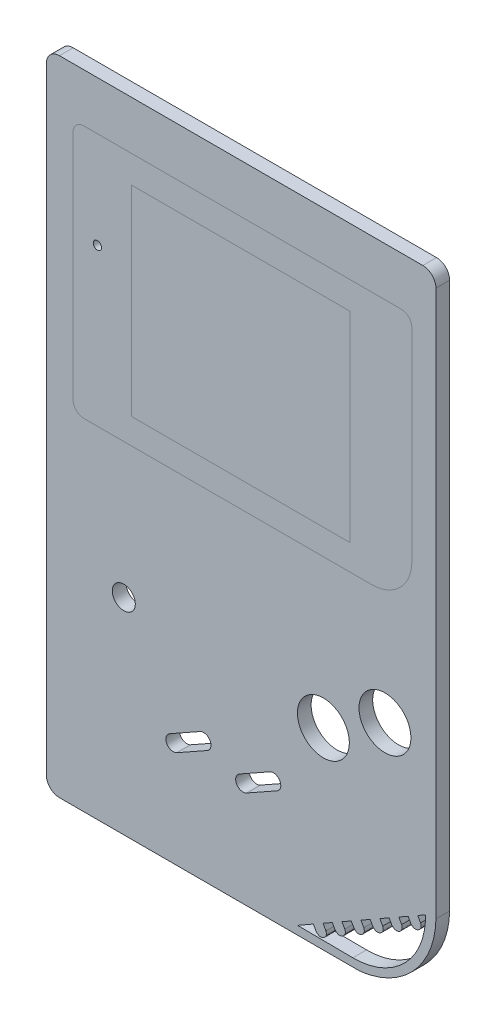
from build123d import *

# Parameters (mm, degrees)
SKETCH1_R           = 2.641507721
SKETCH1_R_2         = 5.95
BOSS_EXTRUDE1_DEPTH = 3.14
SKETCH1_3_W         = 50.090098238
SKETCH1_3_H         = 45.92830966
SKETCH1_3_R         = 0.946417344
BOSS_EXTRUDE2_DEPTH = 3.14
SKETCH1_4_W         = 50.090098238
SKETCH1_4_H         = 45.92830966
BOSS_EXTRUDE3_DEPTH = 3.14


with BuildPart() as part:
    # Sketch1 → Boss-Extrude1 (new body)
    with BuildSketch(Plane.XY):
        with BuildLine():
            add(Edge.make_bspline(
                [(-41.648963672, 73.647136153), (-44.643488897, 73.643488897), (-44.647136153, 70.648963672)],
                knots=[3.927599805, 3.927599805, 3.927599805, 5.497178156, 5.497178156, 5.497178156], degree=2, weights=[1, 0.707537269, 1]))
            Line((-44.647136153, 70.648963672), (-44.647136153, -70.648963672))
            add(Edge.make_bspline(
                [(-44.647136153, -70.648963672), (-44.643488897, -73.643488897), (-41.648963672, -73.647136153)],
                knots=[3.927599805, 3.927599805, 3.927599805, 5.497178156, 5.497178156, 5.497178156], degree=2, weights=[1, 0.707537269, 1]))
            Line((-41.648963672, -73.647136153), (27.093393639, -73.647136153))
            add(Edge.make_bspline(
                [(44.647136153, -54.550700861), (44.629350083, -55.622608831), (44.523578432, -56.687840097), (44.215717336, -58.366181711), (44.071515423, -58.983678353), (43.719242041, -60.213836545), (43.51280516, -60.820227412), (42.807525079, -62.600781834), (42.22206304, -63.742215888), (41.337337041, -65.108539745), (41.152542037, -65.37883334), (40.771685792, -65.906986664), (40.57512321, -66.165654002), (39.967232089, -66.92560473), (39.108255703, -67.89614606), (38.152323748, -68.781197278), (37.146406736, -69.622175477), (36.615243643, -70.022491506), (34.981146078, -71.128530207), (33.83112161, -71.747972893), (32.318701378, -72.376617626), (32.012437216, -72.49499434), (31.392225647, -72.716804064), (31.077608459, -72.820394039), (30.133341911, -73.105042114), (29.500121034, -73.261325902), (28.276366882, -73.499851982), (27.686391293, -73.587126278), (27.093393639, -73.647136153)],
                knots=[0.018260035, 0.018260035, 0.018260035, 0.018260035, 0.125, 0.125, 0.1875, 0.1875, 0.25, 0.25, 0.375, 0.375, 0.40625, 0.40625, 0.4375, 0.4375, 0.5, 0.5625, 0.5625, 0.625, 0.625, 0.75, 0.75, 0.78125, 0.78125, 0.8125, 0.8125, 0.875, 0.875, 0.932610516, 0.932610516, 0.932610516, 0.932610516], degree=3))
            Line((44.647136153, -54.550700861), (44.647136153, 70.648963672))
            add(Edge.make_bspline(
                [(44.647136153, 70.648963672), (44.643488897, 73.643488897), (41.648963672, 73.647136153)],
                knots=[3.927599805, 3.927599805, 3.927599805, 5.497178156, 5.497178156, 5.497178156], degree=2, weights=[1, 0.707537269, 1]))
            Line((41.648963672, 73.647136153), (-41.648963672, 73.647136153))
        make_face()
        with BuildLine():
            Line((38.261273047, -57.229278105), (38.907697093, -58.387645821))
            add(Edge.make_bspline(
                [(41.127626747, -57.132855291), (41.177512702, -57.275656276), (41.228106722, -57.420254043), (41.256744151, -57.64558809), (41.258297908, -57.721643961), (41.241650366, -57.87609041), (41.224028558, -57.95294291), (41.148484091, -58.17567951), (41.066535325, -58.317956891), (40.857909664, -58.566528441), (40.727723519, -58.674853763), (40.444119985, -58.836761885), (40.286598668, -58.894664054), (39.968707451, -58.950297468), (39.803862255, -58.948271189), (39.500496898, -58.865028882), (39.366175077, -58.78700698), (39.123752347, -58.600527557), (39.016103627, -58.493707281), (38.907697093, -58.387645821)],
                knots=[0, 0, 0, 0, 0.125, 0.125, 0.1875, 0.1875, 0.25, 0.25, 0.375, 0.375, 0.5, 0.5, 0.625, 0.625, 0.75, 0.75, 0.875, 0.875, 1, 1, 1, 1], degree=3))
            Line((41.127626747, -57.132855291), (40.475513206, -55.964292213))
            Line((40.475513206, -55.964292213), (42.251050135, -54.949935592))
            Line((42.251050135, -54.949935592), (42.252455494, -55.053896358))
            add(Edge.make_bspline(
                [(25.602086463, -71.801321679), (42.480622356, -71.932432252), (42.252455494, -55.053896358)],
                knots=[5.7564235, 5.7564235, 5.7564235, 7.348402458, 7.348402458, 7.348402458], degree=2, weights=[1, 0.69957807, 1]))
            Line((25.602086463, -71.801321679), (12.926613949, -71.702860031))
            Line((12.926613949, -71.702860031), (16.553952187, -69.630577275))
            Line((16.553952187, -69.630577275), (17.200376234, -70.788944991))
            add(Edge.make_bspline(
                [(19.420305888, -69.534154461), (19.470191843, -69.676955446), (19.520785863, -69.821553213), (19.549423292, -70.04688726), (19.550977048, -70.122943131), (19.534329506, -70.27738958), (19.516707699, -70.35424208), (19.441163231, -70.57697868), (19.359214465, -70.719256061), (19.150588804, -70.967827611), (19.02040266, -71.076152933), (18.736799125, -71.238061055), (18.579277808, -71.295963224), (18.261386592, -71.351596638), (18.096541395, -71.349570359), (17.793176039, -71.266328052), (17.658854217, -71.18830615), (17.416431488, -71.001826727), (17.308782767, -70.895006451), (17.200376234, -70.788944991)],
                knots=[0, 0, 0, 0, 0.125, 0.125, 0.1875, 0.1875, 0.25, 0.25, 0.375, 0.375, 0.5, 0.5, 0.625, 0.625, 0.75, 0.75, 0.875, 0.875, 1, 1, 1, 1], degree=3))
            Line((19.420305888, -69.534154461), (18.76819331, -68.365590833))
            Line((18.76819331, -68.365590833), (20.895416359, -67.150317441))
            Line((20.895416359, -67.150317441), (21.541840405, -68.308685157))
            add(Edge.make_bspline(
                [(23.76177006, -67.053894627), (23.811656014, -67.196695612), (23.862250035, -67.341293379), (23.890887464, -67.566627426), (23.89244122, -67.642683297), (23.875793678, -67.797129746), (23.858171871, -67.873982246), (23.782627403, -68.096718846), (23.700678637, -68.238996227), (23.492052976, -68.487567777), (23.361866832, -68.595893099), (23.078263297, -68.757801221), (22.92074198, -68.81570339), (22.602850764, -68.871336804), (22.438005567, -68.869310525), (22.134640211, -68.786068218), (22.000318389, -68.708046316), (21.75789566, -68.521566893), (21.650246939, -68.414746617), (21.541840405, -68.308685157)],
                knots=[0, 0, 0, 0, 0.125, 0.125, 0.1875, 0.1875, 0.25, 0.25, 0.375, 0.375, 0.5, 0.5, 0.625, 0.625, 0.75, 0.75, 0.875, 0.875, 1, 1, 1, 1], degree=3))
            Line((23.76177006, -67.053894627), (23.109656518, -65.885331549))
            Line((23.109656518, -65.885331549), (25.236880531, -64.670057607))
            Line((25.236880531, -64.670057607), (25.883304577, -65.828425323))
            add(Edge.make_bspline(
                [(28.103234232, -64.573634793), (28.153120186, -64.716435778), (28.203714207, -64.861033545), (28.232351636, -65.086367592), (28.233905392, -65.162423463), (28.21725785, -65.316869912), (28.199636043, -65.393722412), (28.124091575, -65.616459012), (28.042142809, -65.758736393), (27.833517148, -66.007307943), (27.703331004, -66.115633265), (27.419727469, -66.277541387), (27.262206152, -66.335443556), (26.944314936, -66.39107697), (26.779469739, -66.389050691), (26.476104383, -66.305808384), (26.341782561, -66.227786482), (26.099359832, -66.041307059), (25.991711111, -65.934486783), (25.883304577, -65.828425323)],
                knots=[0, 0, 0, 0, 0.125, 0.125, 0.1875, 0.1875, 0.25, 0.25, 0.375, 0.375, 0.5, 0.5, 0.625, 0.625, 0.75, 0.75, 0.875, 0.875, 1, 1, 1, 1], degree=3))
            Line((28.103234232, -64.573634793), (27.45112069, -63.405071715))
            Line((27.45112069, -63.405071715), (29.578344703, -62.189797773))
            Line((29.578344703, -62.189797773), (30.224768749, -63.348165489))
            add(Edge.make_bspline(
                [(32.444698404, -62.093374959), (32.494584358, -62.236175944), (32.545178379, -62.380773711), (32.573815808, -62.606107758), (32.575369564, -62.682163629), (32.558722022, -62.836610078), (32.541100215, -62.913462578), (32.465555747, -63.136199178), (32.383606981, -63.278476559), (32.17498132, -63.527048109), (32.044795175, -63.635373431), (31.761191641, -63.797281553), (31.603670324, -63.855183722), (31.285779108, -63.910817136), (31.120933911, -63.908790857), (30.817568555, -63.82554855), (30.683246733, -63.747526648), (30.440824003, -63.561047225), (30.333175283, -63.454226949), (30.224768749, -63.348165489)],
                knots=[0, 0, 0, 0, 0.125, 0.125, 0.1875, 0.1875, 0.25, 0.25, 0.375, 0.375, 0.5, 0.5, 0.625, 0.625, 0.75, 0.75, 0.875, 0.875, 1, 1, 1, 1], degree=3))
            Line((32.444698404, -62.093374959), (31.792584862, -60.924811881))
            Line((31.792584862, -60.924811881), (33.919808875, -59.709537939))
            Line((33.919808875, -59.709537939), (34.566232921, -60.867905655))
            add(Edge.make_bspline(
                [(36.786162575, -59.613115125), (36.83604853, -59.75591611), (36.88664255, -59.900513877), (36.91527998, -60.125847924), (36.916833736, -60.201903795), (36.900186194, -60.356350244), (36.882564387, -60.433202744), (36.807019919, -60.655939344), (36.725071153, -60.798216725), (36.516445492, -61.046788275), (36.386259347, -61.155113597), (36.102655813, -61.317021719), (35.945134496, -61.374923888), (35.62724328, -61.430557302), (35.462398083, -61.428531023), (35.159032726, -61.345288716), (35.024710905, -61.267266814), (34.782288175, -61.080787391), (34.674639455, -60.973967115), (34.566232921, -60.867905655)],
                knots=[0, 0, 0, 0, 0.125, 0.125, 0.1875, 0.1875, 0.25, 0.25, 0.375, 0.375, 0.5, 0.5, 0.625, 0.625, 0.75, 0.75, 0.875, 0.875, 1, 1, 1, 1], degree=3))
            Line((36.786162575, -59.613115125), (36.134049034, -58.444552047))
            Line((36.134049034, -58.444552047), (38.261273047, -57.229278105))
        make_face(mode=Mode.SUBTRACT)
        with BuildLine():
            Line((39.139308268, 60.005147218), (39.139308268, 13.683084381))
            ThreePointArc((39.139308268, 13.683084381), (36.430045993, 7.142346655), (29.889308268, 4.433084381))
            Line((29.889308268, 4.433084381), (-36.027217939, 4.433084381))
            ThreePointArc((-36.027217939, 4.433084381), (-37.794984892, 5.165317428), (-38.527217939, 6.933084381))
            Line((-38.527217939, 6.933084381), (-38.527217939, 60.005147218))
            ThreePointArc((-38.527217939, 60.005147218), (-37.794984892, 61.772914171), (-36.027217939, 62.505147218))
            Line((-36.027217939, 62.505147218), (36.639308268, 62.505147218))
            ThreePointArc((36.639308268, 62.505147218), (38.40707522, 61.772914171), (39.139308268, 60.005147218))
        make_face(mode=Mode.SUBTRACT)
        with BuildLine():
            ThreePointArc((-9.42859141, -44.400456958), (-7.129702973, -45.04414572), (-7.773391736, -47.343034157))
            Line((-7.773391736, -47.343034157), (-14.745996033, -51.265124074))
            ThreePointArc((-14.745996033, -51.265124074), (-17.044884469, -50.621435312), (-16.401195707, -48.322546875))
            Line((-16.401195707, -48.322546875), (-9.42859141, -44.400456958))
        make_face(mode=Mode.SUBTRACT)
        with Locations((-26.900831216, -26.517202566)):
            Circle(SKETCH1_R, mode=Mode.SUBTRACT)
        with BuildLine():
            ThreePointArc((1.254003967, -51.265124074), (-1.044884469, -50.621435312), (-0.401195707, -48.322546875))
            Line((-0.401195707, -48.322546875), (6.57140859, -44.400456958))
            ThreePointArc((6.57140859, -44.400456958), (8.870297027, -45.04414572), (8.226608264, -47.343034157))
            Line((8.226608264, -47.343034157), (1.254003967, -51.265124074))
        make_face(mode=Mode.SUBTRACT)
        with Locations((18.849494268, -29.546234455)):
            Circle(SKETCH1_R_2, mode=Mode.SUBTRACT)
        with Locations((32.960239, -21.476652312)):
            Circle(SKETCH1_R_2, mode=Mode.SUBTRACT)
    extrude(amount=BOSS_EXTRUDE1_DEPTH)


with BuildPart() as body_2:
    # Sketch1<3> → Boss-Extrude2 (new body)
    with BuildSketch(Plane.XY):
        with BuildLine():
            Line((39.139308268, 13.683084381), (39.139308268, 60.005147218))
            ThreePointArc((39.139308268, 60.005147218), (38.40707522, 61.772914171), (36.639308268, 62.505147218))
            Line((36.639308268, 62.505147218), (-36.027217939, 62.505147218))
            ThreePointArc((-36.027217939, 62.505147218), (-37.794984892, 61.772914171), (-38.527217939, 60.005147218))
            Line((-38.527217939, 60.005147218), (-38.527217939, 6.933084381))
            ThreePointArc((-38.527217939, 6.933084381), (-37.794984892, 5.165317428), (-36.027217939, 4.433084381))
            Line((-36.027217939, 4.433084381), (29.889308268, 4.433084381))
            ThreePointArc((29.889308268, 4.433084381), (36.430045993, 7.142346655), (39.139308268, 13.683084381))
        make_face()
        with Locations((-0.122821054, 33.25213261)):
            Rectangle(SKETCH1_3_W, SKETCH1_3_H, mode=Mode.SUBTRACT)
        with Locations((-32.953932198, 40.341063425)):
            Circle(SKETCH1_3_R, mode=Mode.SUBTRACT)
    extrude(amount=BOSS_EXTRUDE2_DEPTH)


with BuildPart() as body_3:
    # Sketch1<4> → Boss-Extrude3 (new body)
    with BuildSketch(Plane.XY):
        with Locations((-0.122821054, 33.25213261)):
            Rectangle(SKETCH1_4_W, SKETCH1_4_H)
    extrude(amount=BOSS_EXTRUDE3_DEPTH)


solid = Compound([part.part, body_2.part, body_3.part])
